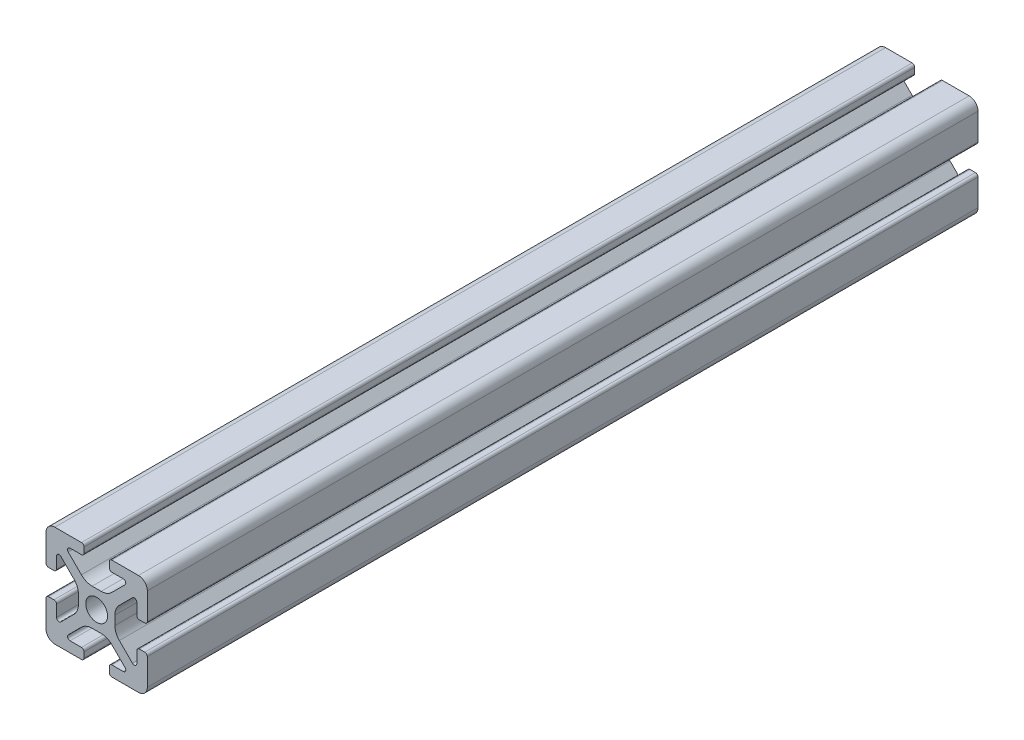
from build123d import *

# Parameters (mm, degrees)
BOSS_EXTRUDE1_DEPTH = 82


with BuildPart() as part:
    # Sketch4 → Boss-Extrude1 (new, symmetric)
    with BuildSketch(Plane.XY):
        with BuildLine():
            Line((3, -10), (8.25, -10))
            ThreePointArc((8.25, -10), (9.487436867, -9.487436867), (10, -8.25))
            Line((10, -8.25), (10, -3))
            ThreePointArc((10, -3), (9.853553391, -2.646446609), (9.5, -2.5))
            Line((9.5, -2.5), (8.424621202, -2.5))
            ThreePointArc((8.424621202, -2.5), (8.071067812, -2.646446609), (7.924621202, -3))
            Line((7.924621202, -3), (7.924621202, -5.25))
            ThreePointArc((7.924621202, -5.25), (7.615962919, -5.711939766), (7.071067812, -5.603553391))
            Line((7.071067812, -5.603553391), (4.478679656, -3.011165235))
            ThreePointArc((4.478679656, -3.011165235), (3.828361402, -2.037895189), (3.6, -0.889844892))
            Line((3.6, -0.889844892), (3.6, 0))
            Line((3.6, 0), (2.15, 0))
            ThreePointArc((2.15, 0), (1.52027958, -1.52027958), (0, -2.15))
            Line((0, -2.15), (0, -3.6))
            Line((0, -3.6), (0.889844892, -3.6))
            ThreePointArc((0.889844892, -3.6), (2.037895189, -3.828361402), (3.011165235, -4.478679656))
            Line((3.011165235, -4.478679656), (5.603553391, -7.071067812))
            ThreePointArc((5.603553391, -7.071067812), (5.711939766, -7.615962919), (5.25, -7.924621202))
            Line((5.25, -7.924621202), (3, -7.924621202))
            ThreePointArc((3, -7.924621202), (2.646446609, -8.071067812), (2.5, -8.424621202))
            Line((2.5, -8.424621202), (2.5, -9.5))
            ThreePointArc((2.5, -9.5), (2.646446609, -9.853553391), (3, -10))
        make_face()
    extrude(amount=BOSS_EXTRUDE1_DEPTH, both=True)

    # Mirror1: part across plane


with BuildPart() as part_1:
    add(part.part)
    add(part.part.mirror(Plane(origin=(0, 0, 0), x_dir=(0, 0, 1), z_dir=(1, 0, 0))))

    # Mirror2: part across plane


with BuildPart() as part_2:
    add(part_1.part)
    add(part_1.part.mirror(Plane.ZX))


solid = part_2.part
